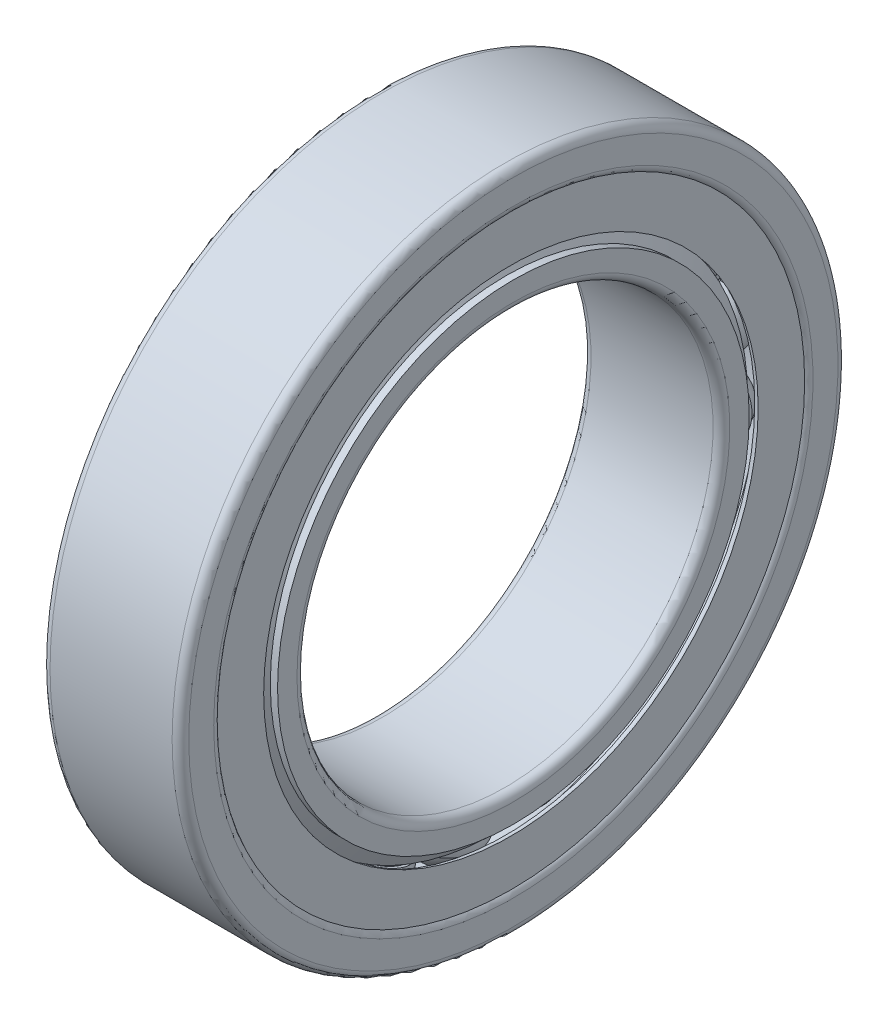
from build123d import *

# Parameters (mm, degrees)
SKETCH_5_W               = 0.675
SKETCH_5_H               = 0.45
PATTERN_CIRCULAR_5_COUNT = 22
PATTERN_CIRCULAR_2_COUNT = 22


with BuildPart() as part:
    # 草图2 → 旋转1 (revolve)
    with BuildSketch(Plane.XY):
        with BuildLine():
            Line((1.95, 9), (2.238675, 8.5))
            Line((2.238675, 8.5), (2.5, 8.5))
            Line((2.5, 8.5), (2.5, 7.8))
            ThreePointArc((2.5, 7.8), (2.412132, 7.587868), (2.2, 7.5))
            Line((2.2, 7.5), (-2.2, 7.5))
            ThreePointArc((-2.2, 7.5), (-2.412132, 7.587868), (-2.5, 7.8))
            Line((-2.5, 7.8), (-2.5, 8.5))
            Line((-2.5, 8.5), (-2.238675, 8.5))
            Line((-2.238675, 8.5), (-1.95, 9))
            Line((-1.95, 9), (-0.838525, 9))
            ThreePointArc((-0.838525, 9), (0, 8.625), (0.838525, 9))
            Line((0.838525, 9), (1.95, 9))
        make_face()
        with BuildLine():
            Line((-2.5, 11.7), (-2.5, 10.8))
            ThreePointArc((-2.5, 10.8), (-2.412132, 10.587868), (-2.2, 10.5))
            Line((-2.2, 10.5), (-0.838525, 10.5))
            ThreePointArc((-0.838525, 10.5), (0, 10.875), (0.838525, 10.5))
            Line((0.838525, 10.5), (2.2, 10.5))
            ThreePointArc((2.2, 10.5), (2.412132, 10.587868), (2.5, 10.8))
            Line((2.5, 10.8), (2.5, 11.7))
            ThreePointArc((2.5, 11.7), (2.412132, 11.912132), (2.2, 12))
            Line((2.2, 12), (-2.2, 12))
            ThreePointArc((-2.2, 12), (-2.412132, 11.912132), (-2.5, 11.7))
        make_face()
    revolve(axis=Axis((-3.5, 0, 0), (1, 0, 0)))


with BuildPart() as body_2:
    # 草图5 → 旋转3 (revolve)
    with BuildSketch(Plane.XY):
        with Locations((0, 9.75)):
            Rectangle(SKETCH_5_W, SKETCH_5_H)
    revolve(axis=Axis((-19.927092, 0, 0), (1, 0, 0)))



with BuildPart() as body_3:
    # 草图3 → 旋转2 (revolve)
    with BuildSketch(Plane.XY):
        with BuildLine():
            ThreePointArc((1.2375, 9.75), (0, 10.9875), (-1.2375, 9.75))
            Line((-1.2375, 9.75), (1.2375, 9.75))
        make_face()
    revolve(axis=Axis((-1.2375, 9.75, 0), (1, 0, 0)))


with BuildPart() as pattern_circular_5_1:
    # 阵列(圆周)5: pattern copy
    add(body_3.part.rotate(Axis((-3.85, 0, 0), (1, 0, 0)), 1 * 360 / PATTERN_CIRCULAR_5_COUNT))


with BuildPart() as pattern_circular_5_2:
    # 阵列(圆周)5: pattern copy
    add(body_3.part.rotate(Axis((-3.85, 0, 0), (1, 0, 0)), 2 * 360 / PATTERN_CIRCULAR_5_COUNT))


with BuildPart() as pattern_circular_5_3:
    # 阵列(圆周)5: pattern copy
    add(body_3.part.rotate(Axis((-3.85, 0, 0), (1, 0, 0)), 3 * 360 / PATTERN_CIRCULAR_5_COUNT))


with BuildPart() as pattern_circular_5_4:
    # 阵列(圆周)5: pattern copy
    add(body_3.part.rotate(Axis((-3.85, 0, 0), (1, 0, 0)), 4 * 360 / PATTERN_CIRCULAR_5_COUNT))


with BuildPart() as pattern_circular_5_5:
    # 阵列(圆周)5: pattern copy
    add(body_3.part.rotate(Axis((-3.85, 0, 0), (1, 0, 0)), 5 * 360 / PATTERN_CIRCULAR_5_COUNT))


with BuildPart() as pattern_circular_5_6:
    # 阵列(圆周)5: pattern copy
    add(body_3.part.rotate(Axis((-3.85, 0, 0), (1, 0, 0)), 6 * 360 / PATTERN_CIRCULAR_5_COUNT))


with BuildPart() as pattern_circular_5_7:
    # 阵列(圆周)5: pattern copy
    add(body_3.part.rotate(Axis((-3.85, 0, 0), (1, 0, 0)), 7 * 360 / PATTERN_CIRCULAR_5_COUNT))


with BuildPart() as pattern_circular_5_8:
    # 阵列(圆周)5: pattern copy
    add(body_3.part.rotate(Axis((-3.85, 0, 0), (1, 0, 0)), 8 * 360 / PATTERN_CIRCULAR_5_COUNT))


with BuildPart() as pattern_circular_5_9:
    # 阵列(圆周)5: pattern copy
    add(body_3.part.rotate(Axis((-3.85, 0, 0), (1, 0, 0)), 9 * 360 / PATTERN_CIRCULAR_5_COUNT))


with BuildPart() as pattern_circular_5_10:
    # 阵列(圆周)5: pattern copy
    add(body_3.part.rotate(Axis((-3.85, 0, 0), (1, 0, 0)), 10 * 360 / PATTERN_CIRCULAR_5_COUNT))


with BuildPart() as pattern_circular_5_11:
    # 阵列(圆周)5: pattern copy
    add(body_3.part.rotate(Axis((-3.85, 0, 0), (1, 0, 0)), 11 * 360 / PATTERN_CIRCULAR_5_COUNT))


with BuildPart() as pattern_circular_5_12:
    # 阵列(圆周)5: pattern copy
    add(body_3.part.rotate(Axis((-3.85, 0, 0), (1, 0, 0)), 12 * 360 / PATTERN_CIRCULAR_5_COUNT))


with BuildPart() as pattern_circular_5_13:
    # 阵列(圆周)5: pattern copy
    add(body_3.part.rotate(Axis((-3.85, 0, 0), (1, 0, 0)), 13 * 360 / PATTERN_CIRCULAR_5_COUNT))


with BuildPart() as pattern_circular_5_14:
    # 阵列(圆周)5: pattern copy
    add(body_3.part.rotate(Axis((-3.85, 0, 0), (1, 0, 0)), 14 * 360 / PATTERN_CIRCULAR_5_COUNT))


with BuildPart() as pattern_circular_5_15:
    # 阵列(圆周)5: pattern copy
    add(body_3.part.rotate(Axis((-3.85, 0, 0), (1, 0, 0)), 15 * 360 / PATTERN_CIRCULAR_5_COUNT))


with BuildPart() as pattern_circular_5_16:
    # 阵列(圆周)5: pattern copy
    add(body_3.part.rotate(Axis((-3.85, 0, 0), (1, 0, 0)), 16 * 360 / PATTERN_CIRCULAR_5_COUNT))


with BuildPart() as pattern_circular_5_17:
    # 阵列(圆周)5: pattern copy
    add(body_3.part.rotate(Axis((-3.85, 0, 0), (1, 0, 0)), 17 * 360 / PATTERN_CIRCULAR_5_COUNT))


with BuildPart() as pattern_circular_5_18:
    # 阵列(圆周)5: pattern copy
    add(body_3.part.rotate(Axis((-3.85, 0, 0), (1, 0, 0)), 18 * 360 / PATTERN_CIRCULAR_5_COUNT))


with BuildPart() as pattern_circular_5_19:
    # 阵列(圆周)5: pattern copy
    add(body_3.part.rotate(Axis((-3.85, 0, 0), (1, 0, 0)), 19 * 360 / PATTERN_CIRCULAR_5_COUNT))


with BuildPart() as pattern_circular_5_20:
    # 阵列(圆周)5: pattern copy
    add(body_3.part.rotate(Axis((-3.85, 0, 0), (1, 0, 0)), 20 * 360 / PATTERN_CIRCULAR_5_COUNT))


with BuildPart() as pattern_circular_5_21:
    # 阵列(圆周)5: pattern copy
    add(body_3.part.rotate(Axis((-3.85, 0, 0), (1, 0, 0)), 21 * 360 / PATTERN_CIRCULAR_5_COUNT))


with BuildPart() as cut_revolve_1_tool:
    # 草图6 → 切除-旋转1 (revolve)
    with BuildSketch(Plane.XY):
        with BuildLine():
            Line((-1.216874, 9.975), (1.216874, 9.975))
            ThreePointArc((1.216874, 9.975), (0, 10.9875), (-1.216874, 9.975))
        make_face()
        with BuildLine():
            Line((-1.216874, 9.525), (1.216874, 9.525))
            ThreePointArc((1.216874, 9.525), (0, 8.5125), (-1.216874, 9.525))
        make_face()
    revolve(axis=Axis((-19.927092, 0, 0), (1, 0, 0)))


with BuildPart() as part_1:
    add(part.part)

    # 切除-旋转1: cut by cut_revolve_1_tool
    add(cut_revolve_1_tool.part, mode=Mode.SUBTRACT)

    # 草图9 → 旋转5 (revolve)
    with BuildSketch(Plane.XY):
        with BuildLine():
            Line((2.2, 10.5), (2.2, 9))
            ThreePointArc((2.2, 9), (2.314805, 8.977164), (2.412132, 8.912132))
            Line((2.412132, 8.912132), (2.412132, 10.587868))
            ThreePointArc((2.412132, 10.587868), (2.314805, 10.522836), (2.2, 10.5))
        make_face()
        with BuildLine():
            Line((-2.412132, 10.587868), (-2.412132, 8.912132))
            ThreePointArc((-2.412132, 8.912132), (-2.314805, 8.977164), (-2.2, 9))
            Line((-2.2, 9), (-2.2, 10.5))
            ThreePointArc((-2.2, 10.5), (-2.314805, 10.522836), (-2.412132, 10.587868))
        make_face()
    revolve(axis=Axis((-19.927092, 0, 0), (1, 0, 0)))


with BuildPart() as body_3_1:
    add(body_3.part)

    # 切除-旋转1: cut by cut_revolve_1_tool
    add(cut_revolve_1_tool.part, mode=Mode.SUBTRACT)


with BuildPart() as pattern_circular_5_1_1:
    add(pattern_circular_5_1.part)

    # 切除-旋转1: cut by cut_revolve_1_tool
    add(cut_revolve_1_tool.part, mode=Mode.SUBTRACT)


with BuildPart() as pattern_circular_5_2_1:
    add(pattern_circular_5_2.part)

    # 切除-旋转1: cut by cut_revolve_1_tool
    add(cut_revolve_1_tool.part, mode=Mode.SUBTRACT)


with BuildPart() as pattern_circular_5_3_1:
    add(pattern_circular_5_3.part)

    # 切除-旋转1: cut by cut_revolve_1_tool
    add(cut_revolve_1_tool.part, mode=Mode.SUBTRACT)


with BuildPart() as pattern_circular_5_4_1:
    add(pattern_circular_5_4.part)

    # 切除-旋转1: cut by cut_revolve_1_tool
    add(cut_revolve_1_tool.part, mode=Mode.SUBTRACT)


with BuildPart() as pattern_circular_5_5_1:
    add(pattern_circular_5_5.part)

    # 切除-旋转1: cut by cut_revolve_1_tool
    add(cut_revolve_1_tool.part, mode=Mode.SUBTRACT)


with BuildPart() as pattern_circular_5_6_1:
    add(pattern_circular_5_6.part)

    # 切除-旋转1: cut by cut_revolve_1_tool
    add(cut_revolve_1_tool.part, mode=Mode.SUBTRACT)


with BuildPart() as pattern_circular_5_7_1:
    add(pattern_circular_5_7.part)

    # 切除-旋转1: cut by cut_revolve_1_tool
    add(cut_revolve_1_tool.part, mode=Mode.SUBTRACT)


with BuildPart() as pattern_circular_5_8_1:
    add(pattern_circular_5_8.part)

    # 切除-旋转1: cut by cut_revolve_1_tool
    add(cut_revolve_1_tool.part, mode=Mode.SUBTRACT)


with BuildPart() as pattern_circular_5_9_1:
    add(pattern_circular_5_9.part)

    # 切除-旋转1: cut by cut_revolve_1_tool
    add(cut_revolve_1_tool.part, mode=Mode.SUBTRACT)


with BuildPart() as pattern_circular_5_10_1:
    add(pattern_circular_5_10.part)

    # 切除-旋转1: cut by cut_revolve_1_tool
    add(cut_revolve_1_tool.part, mode=Mode.SUBTRACT)


with BuildPart() as pattern_circular_5_11_1:
    add(pattern_circular_5_11.part)

    # 切除-旋转1: cut by cut_revolve_1_tool
    add(cut_revolve_1_tool.part, mode=Mode.SUBTRACT)


with BuildPart() as pattern_circular_5_12_1:
    add(pattern_circular_5_12.part)

    # 切除-旋转1: cut by cut_revolve_1_tool
    add(cut_revolve_1_tool.part, mode=Mode.SUBTRACT)


with BuildPart() as pattern_circular_5_13_1:
    add(pattern_circular_5_13.part)

    # 切除-旋转1: cut by cut_revolve_1_tool
    add(cut_revolve_1_tool.part, mode=Mode.SUBTRACT)


with BuildPart() as pattern_circular_5_14_1:
    add(pattern_circular_5_14.part)

    # 切除-旋转1: cut by cut_revolve_1_tool
    add(cut_revolve_1_tool.part, mode=Mode.SUBTRACT)


with BuildPart() as pattern_circular_5_15_1:
    add(pattern_circular_5_15.part)

    # 切除-旋转1: cut by cut_revolve_1_tool
    add(cut_revolve_1_tool.part, mode=Mode.SUBTRACT)


with BuildPart() as pattern_circular_5_16_1:
    add(pattern_circular_5_16.part)

    # 切除-旋转1: cut by cut_revolve_1_tool
    add(cut_revolve_1_tool.part, mode=Mode.SUBTRACT)


with BuildPart() as pattern_circular_5_17_1:
    add(pattern_circular_5_17.part)

    # 切除-旋转1: cut by cut_revolve_1_tool
    add(cut_revolve_1_tool.part, mode=Mode.SUBTRACT)


with BuildPart() as pattern_circular_5_18_1:
    add(pattern_circular_5_18.part)

    # 切除-旋转1: cut by cut_revolve_1_tool
    add(cut_revolve_1_tool.part, mode=Mode.SUBTRACT)


with BuildPart() as pattern_circular_5_19_1:
    add(pattern_circular_5_19.part)

    # 切除-旋转1: cut by cut_revolve_1_tool
    add(cut_revolve_1_tool.part, mode=Mode.SUBTRACT)


with BuildPart() as pattern_circular_5_20_1:
    add(pattern_circular_5_20.part)

    # 切除-旋转1: cut by cut_revolve_1_tool
    add(cut_revolve_1_tool.part, mode=Mode.SUBTRACT)


with BuildPart() as pattern_circular_5_21_1:
    add(pattern_circular_5_21.part)

    # 切除-旋转1: cut by cut_revolve_1_tool
    add(cut_revolve_1_tool.part, mode=Mode.SUBTRACT)


with BuildPart() as body_2_1:
    add(body_2.part)

    add(body_3_1.part)  # 旋转4 merges body 3
    # 草图7 → 旋转4 (revolve)
    with BuildSketch(Plane.XY):
        with BuildLine():
            Line((-1.125, 9.75), (1.125, 9.75))
            ThreePointArc((1.125, 9.75), (0, 10.875), (-1.125, 9.75))
        make_face()
    revolve_4 = revolve(axis=Axis((-1.125, 9.75, 0), (1, 0, 0)))

    # 阵列(圆周)2: 旋转4 ×22 about axis
    pattern_circular_2_axis = Axis((-3.85, 0, 0), (1, 0, 0))
    for i in range(1, PATTERN_CIRCULAR_2_COUNT):
        add(revolve_4.rotate(pattern_circular_2_axis, i * 360 / PATTERN_CIRCULAR_2_COUNT))


solid = Compound([part_1.part, pattern_circular_5_1_1.part, pattern_circular_5_2_1.part, pattern_circular_5_3_1.part, pattern_circular_5_4_1.part, pattern_circular_5_5_1.part, pattern_circular_5_6_1.part, pattern_circular_5_7_1.part, pattern_circular_5_8_1.part, pattern_circular_5_9_1.part, pattern_circular_5_10_1.part, pattern_circular_5_11_1.part, pattern_circular_5_12_1.part, pattern_circular_5_13_1.part, pattern_circular_5_14_1.part, pattern_circular_5_15_1.part, pattern_circular_5_16_1.part, pattern_circular_5_17_1.part, pattern_circular_5_18_1.part, pattern_circular_5_19_1.part, pattern_circular_5_20_1.part, pattern_circular_5_21_1.part, body_2_1.part])
